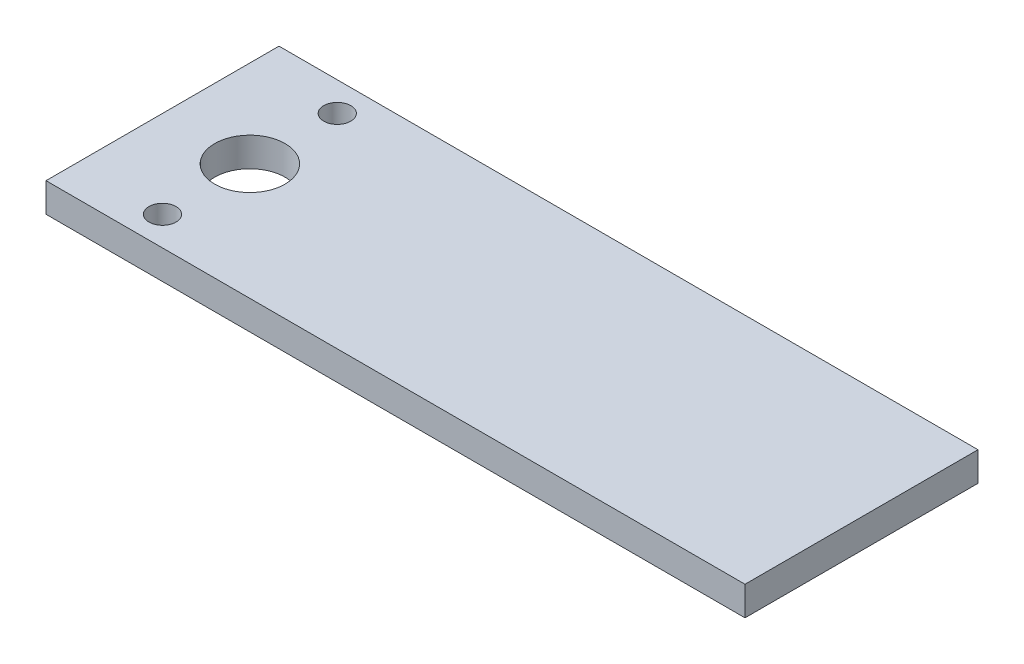
from build123d import *

# Parameters (mm, degrees)
SKETCH1_W           = 76.2
SKETCH1_H           = 25.4
SKETCH1_R           = 1.4732
SKETCH1_R_2         = 3.8354
BOSS_EXTRUDE1_DEPTH = 3.175


with BuildPart() as part:
    # Sketch1 → Boss-Extrude1 (new body)
    with BuildSketch(Plane(origin=(0, 0, 0), x_dir=(1, 0, 0), z_dir=(0, 1, 0))):
        with Locations((38.1, 12.7)):
            Rectangle(SKETCH1_W, SKETCH1_H)
        with Locations((9.525, 22.225)):
            Circle(SKETCH1_R, mode=Mode.SUBTRACT)
        with Locations((9.525, 3.175)):
            Circle(SKETCH1_R, mode=Mode.SUBTRACT)
        with Locations((9.525, 12.7)):
            Circle(SKETCH1_R_2, mode=Mode.SUBTRACT)
    extrude(amount=BOSS_EXTRUDE1_DEPTH)


solid = part.part
